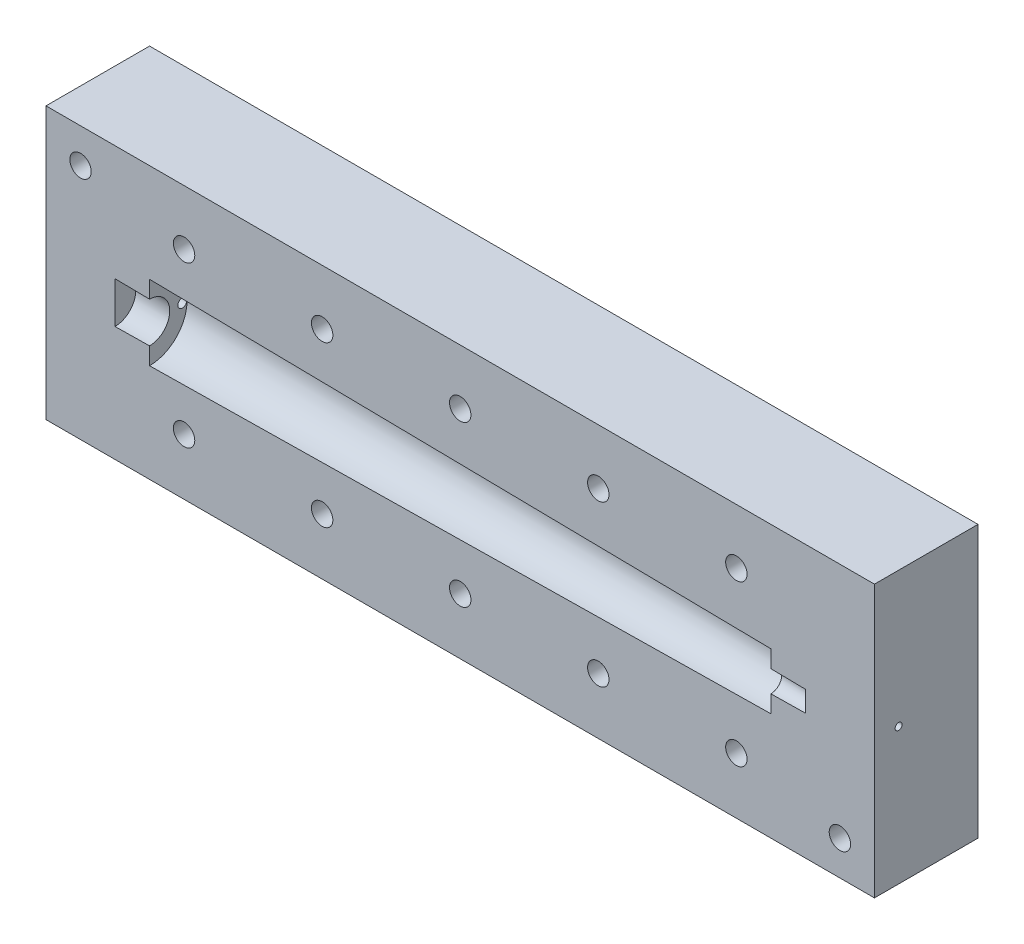
from build123d import *

# Parameters (mm, degrees)
SKIZZE2_W                        = 120
SKIZZE2_H                        = 39.364160046
AUFSATZ_LINEAR_AUSTRAGEN1_DEPTH  = 30
SKIZZE24_R                       = 1.55
SCHNITT_LINEAR_AUSTRAGEN4_DEPTH  = 130.805766806
SKIZZE46_R                       = 2.85
SCHNITT_LINEAR_AUSTRAGEN15_DEPTH = 10
SCHNITT_LINEAR_START             = -5
SCHNITT_LINEAR_AUSTRAGEN25_DEPTH = 2.7
LINEARES_MUSTER1_COUNT           = 5
LINEARES_MUSTER1_PITCH           = 20
SPIEGELN2_COPY_1_SKETCH_R        = 2.85
SPIEGELN2_COPY_1_DEPTH           = 10
SPIEGELN2_COPY_2_SKETCH_R        = 2.85
SPIEGELN2_COPY_2_DEPTH           = 10
SPIEGELN2_COPY_3_SKETCH_R        = 2.85
SPIEGELN2_COPY_3_DEPTH           = 10
SPIEGELN2_COPY_4_SKETCH_R        = 2.85
SPIEGELN2_COPY_4_DEPTH           = 10
SPIEGELN2_START                  = -5
SPIEGELN2_COPY_5_DEPTH           = 2.7
SPIEGELN2_COPY_6_DEPTH           = 2.7
SPIEGELN2_COPY_7_DEPTH           = 2.7
SPIEGELN2_COPY_8_DEPTH           = 2.7
SKIZZE51_R                       = 1.55
SCHNITT_LINEAR_AUSTRAGEN26_DEPTH = 130.805766806
SKIZZE67_R                       = 0.5
SCHNITT_LINEAR_AUSTRAGEN28_DEPTH = 16
SKIZZE68_R                       = 0.65
SCHNITT_LINEAR_AUSTRAGEN30_DEPTH = 16
SKIZZE70_R                       = 2
SCHNITT_LINEAR_AUSTRAGEN31_DEPTH = 6
ABSPALTEN3_START                 = 15
ABSPALTEN3_OUTLINE_W             = 120
ABSPALTEN3_OUTLINE_H             = 39.364160046
ABSPALTEN3_OUTLINE_R             = 1.55
ABSPALTEN3_DEPTH                 = 15


# Read off the part's stored shape, not the designer's step: Abspalten3
with BuildPart() as part:
    # Skizze2 → Aufsatz-Linear austragen1 (new body)
    with BuildSketch(Plane.XY):
        with Locations((60, 19.682080023)):
            Rectangle(SKIZZE2_W, SKIZZE2_H)
    extrude(amount=AUFSATZ_LINEAR_AUSTRAGEN1_DEPTH)

    # Skizze24 → Schnitt-Linear austragen4 (cut, through all)
    with BuildSketch(Plane.XY.offset(30)):
        with Locations((20, 31.364160046)):
            Circle(SKIZZE24_R)
        with Locations((40, 31.364160046)):
            Circle(SKIZZE24_R)
        with Locations((60, 31.364160046)):
            Circle(SKIZZE24_R)
        with Locations((80, 31.364160046)):
            Circle(SKIZZE24_R)
        with Locations((100, 31.364160046)):
            Circle(SKIZZE24_R)
    schnitt_linear_austragen4 = extrude(amount=-SCHNITT_LINEAR_AUSTRAGEN4_DEPTH, mode=Mode.SUBTRACT)

    # Skizze46 → Schnitt-Linear austragen15 (cut)
    with BuildSketch(Plane(origin=(0, 0, 0), x_dir=(-1, 0, 0), z_dir=(0, 0, -1))):
        with Locations((-100, 31.364160046)):
            Circle(SKIZZE46_R)
    schnitt_linear_austragen15 = extrude(amount=-SCHNITT_LINEAR_AUSTRAGEN15_DEPTH, mode=Mode.SUBTRACT)

    # Skizze50 → Schnitt-Linear austragen25 (cut)
    with BuildSketch(Plane.XY.offset(30).offset(SCHNITT_LINEAR_START)):
        Polygon((97.15, 33.009608314), (97.15, 39.364160046), (102.85, 39.364160046), (102.85, 33.009608314), (102.85, 29.718711779), (100, 28.073263512), (97.15, 29.718711779), align=None)
    schnitt_linear_austragen25 = extrude(amount=-SCHNITT_LINEAR_AUSTRAGEN25_DEPTH, mode=Mode.SUBTRACT)

    # Lineares Muster1: Schnitt-Linear austragen15, Schnitt-Linear austragen25 ×5
    with Locations(*[(-i * LINEARES_MUSTER1_PITCH, 0, 0) for i in range(1, LINEARES_MUSTER1_COUNT)]):
        add(schnitt_linear_austragen15, mode=Mode.SUBTRACT)
        add(schnitt_linear_austragen25, mode=Mode.SUBTRACT)

    # Spiegeln2: Schnitt-Linear austragen15, Schnitt-Linear austragen25 across plane
    add(schnitt_linear_austragen15.mirror(Plane.ZX.offset(19.764160046)), mode=Mode.SUBTRACT)
    add(schnitt_linear_austragen25.mirror(Plane.ZX.offset(19.764160046)), mode=Mode.SUBTRACT)

    # Spiegeln2 copy 1 sketch → Spiegeln2 copy 1 (cut)
    with BuildSketch(Plane(origin=(-20, 39.528320093, 0), x_dir=(-1, 0, 0), z_dir=(0, 0, -1))):
        with Locations((-100, -31.364160046)):
            Circle(SPIEGELN2_COPY_1_SKETCH_R)
    extrude(amount=-SPIEGELN2_COPY_1_DEPTH, mode=Mode.SUBTRACT)

    # Spiegeln2 copy 2 sketch → Spiegeln2 copy 2 (cut)
    with BuildSketch(Plane(origin=(-40, 39.528320093, 0), x_dir=(-1, 0, 0), z_dir=(0, 0, -1))):
        with Locations((-100, -31.364160046)):
            Circle(SPIEGELN2_COPY_2_SKETCH_R)
    extrude(amount=-SPIEGELN2_COPY_2_DEPTH, mode=Mode.SUBTRACT)

    # Spiegeln2 copy 3 sketch → Spiegeln2 copy 3 (cut)
    with BuildSketch(Plane(origin=(-60, 39.528320093, 0), x_dir=(-1, 0, 0), z_dir=(0, 0, -1))):
        with Locations((-100, -31.364160046)):
            Circle(SPIEGELN2_COPY_3_SKETCH_R)
    extrude(amount=-SPIEGELN2_COPY_3_DEPTH, mode=Mode.SUBTRACT)

    # Spiegeln2 copy 4 sketch → Spiegeln2 copy 4 (cut)
    with BuildSketch(Plane(origin=(-80, 39.528320093, 0), x_dir=(-1, 0, 0), z_dir=(0, 0, -1))):
        with Locations((-100, -31.364160046)):
            Circle(SPIEGELN2_COPY_4_SKETCH_R)
    extrude(amount=-SPIEGELN2_COPY_4_DEPTH, mode=Mode.SUBTRACT)

    # Spiegeln2 copy 5 sketch → Spiegeln2 copy 5 (cut)
    with BuildSketch(Plane(origin=(-20, 39.528320093, 30), x_dir=(1, 0, 0), z_dir=(0, 0, 1)).offset(SPIEGELN2_START)):
        Polygon((97.15, -33.009608314), (97.15, -39.364160046), (102.85, -39.364160046), (102.85, -33.009608314), (102.85, -29.718711779), (100, -28.073263512), (97.15, -29.718711779), align=None)
    extrude(amount=-SPIEGELN2_COPY_5_DEPTH, mode=Mode.SUBTRACT)

    # Spiegeln2 copy 6 sketch → Spiegeln2 copy 6 (cut)
    with BuildSketch(Plane(origin=(-40, 39.528320093, 30), x_dir=(1, 0, 0), z_dir=(0, 0, 1)).offset(SPIEGELN2_START)):
        Polygon((97.15, -33.009608314), (97.15, -39.364160046), (102.85, -39.364160046), (102.85, -33.009608314), (102.85, -29.718711779), (100, -28.073263512), (97.15, -29.718711779), align=None)
    extrude(amount=-SPIEGELN2_COPY_6_DEPTH, mode=Mode.SUBTRACT)

    # Spiegeln2 copy 7 sketch → Spiegeln2 copy 7 (cut)
    with BuildSketch(Plane(origin=(-60, 39.528320093, 30), x_dir=(1, 0, 0), z_dir=(0, 0, 1)).offset(SPIEGELN2_START)):
        Polygon((97.15, -33.009608314), (97.15, -39.364160046), (102.85, -39.364160046), (102.85, -33.009608314), (102.85, -29.718711779), (100, -28.073263512), (97.15, -29.718711779), align=None)
    extrude(amount=-SPIEGELN2_COPY_7_DEPTH, mode=Mode.SUBTRACT)

    # Spiegeln2 copy 8 sketch → Spiegeln2 copy 8 (cut)
    with BuildSketch(Plane(origin=(-80, 39.528320093, 30), x_dir=(1, 0, 0), z_dir=(0, 0, 1)).offset(SPIEGELN2_START)):
        Polygon((97.15, -33.009608314), (97.15, -39.364160046), (102.85, -39.364160046), (102.85, -33.009608314), (102.85, -29.718711779), (100, -28.073263512), (97.15, -29.718711779), align=None)
    extrude(amount=-SPIEGELN2_COPY_8_DEPTH, mode=Mode.SUBTRACT)

    # Spiegeln3: Schnitt-Linear austragen4 across plane
    add(schnitt_linear_austragen4.mirror(Plane.ZX.offset(19.764160046)), mode=Mode.SUBTRACT)

    # Skizze51 → Schnitt-Linear austragen26 (cut, through all)
    with BuildSketch(Plane.XY.offset(30)):
        with Locations((5, 34.364160046)):
            Circle(SKIZZE51_R)
        with Locations((115, 5)):
            Circle(SKIZZE51_R)
    extrude(amount=-SCHNITT_LINEAR_AUSTRAGEN26_DEPTH, mode=Mode.SUBTRACT)

    # Skizze66 → Schnitt-Rotation5 (revolve, cut)
    with BuildSketch(Plane.XY.offset(15), mode=Mode.PRIVATE) as schnitt_rotation5_sk:
        Polygon((110, 19.682080023), (110, 21.182080023), (10, 22.682080023), (10, 19.682080023), align=None)
        Polygon((105, 19.682080023), (105, 23.757361257), (15, 25.107361257), (15, 19.682080023), align=None)
    revolve(schnitt_rotation5_sk.sketch.rotate(Axis((10, 19.682080023, 15), (1, 0, 0)), 180), axis=Axis((10, 19.682080023, 15), (1, 0, 0)), mode=Mode.SUBTRACT)

    # Skizze67 → Schnitt-Linear austragen28 (cut)
    with BuildSketch(Plane(origin=(120, 0, 0), x_dir=(0, 0, -1), z_dir=(1, 0, 0))):
        with Locations((-18.5, 19.764160046)):
            Circle(SKIZZE67_R)
    schnitt_linear_austragen28 = extrude(amount=-SCHNITT_LINEAR_AUSTRAGEN28_DEPTH, mode=Mode.SUBTRACT)

    # Spiegeln5: Schnitt-Linear austragen28 across plane
    add(schnitt_linear_austragen28.mirror(Plane.XY.offset(15)), mode=Mode.SUBTRACT)

    # Skizze68 → Schnitt-Linear austragen30 (cut)
    with BuildSketch(Plane.ZY):
        with Locations((10.25, 19.764160046)):
            Circle(SKIZZE68_R)
    extrude(amount=-SCHNITT_LINEAR_AUSTRAGEN30_DEPTH, mode=Mode.SUBTRACT)

    # Skizze70 → Schnitt-Linear austragen31 (cut)
    with BuildSketch(Plane.ZY):
        with Locations((10.25, 19.764160046)):
            Circle(SKIZZE70_R)
    extrude(amount=-SCHNITT_LINEAR_AUSTRAGEN31_DEPTH, mode=Mode.SUBTRACT)

    # Abspalten3 outline → Abspalten3 (cut)
    with BuildSketch(Plane.XY.offset(ABSPALTEN3_START)):
        with Locations((60, 19.682080023)):
            Rectangle(ABSPALTEN3_OUTLINE_W, ABSPALTEN3_OUTLINE_H)
        with Locations((115, 5)):
            Circle(ABSPALTEN3_OUTLINE_R, mode=Mode.SUBTRACT)
        with Locations((5, 34.364160046)):
            Circle(ABSPALTEN3_OUTLINE_R, mode=Mode.SUBTRACT)
        with Locations((20, 31.364160046)):
            Circle(ABSPALTEN3_OUTLINE_R, mode=Mode.SUBTRACT)
        with Locations((40, 31.364160046)):
            Circle(ABSPALTEN3_OUTLINE_R, mode=Mode.SUBTRACT)
        with Locations((60, 31.364160046)):
            Circle(ABSPALTEN3_OUTLINE_R, mode=Mode.SUBTRACT)
        with Locations((80, 31.364160046)):
            Circle(ABSPALTEN3_OUTLINE_R, mode=Mode.SUBTRACT)
        with Locations((100, 31.364160046)):
            Circle(ABSPALTEN3_OUTLINE_R, mode=Mode.SUBTRACT)
        with Locations((20, 8.164160046)):
            Circle(ABSPALTEN3_OUTLINE_R, mode=Mode.SUBTRACT)
        with Locations((40, 8.164160046)):
            Circle(ABSPALTEN3_OUTLINE_R, mode=Mode.SUBTRACT)
        with Locations((60, 8.164160046)):
            Circle(ABSPALTEN3_OUTLINE_R, mode=Mode.SUBTRACT)
        with Locations((80, 8.164160046)):
            Circle(ABSPALTEN3_OUTLINE_R, mode=Mode.SUBTRACT)
        with Locations((100, 8.164160046)):
            Circle(ABSPALTEN3_OUTLINE_R, mode=Mode.SUBTRACT)
    extrude(amount=ABSPALTEN3_DEPTH, mode=Mode.SUBTRACT)


solid = part.part
